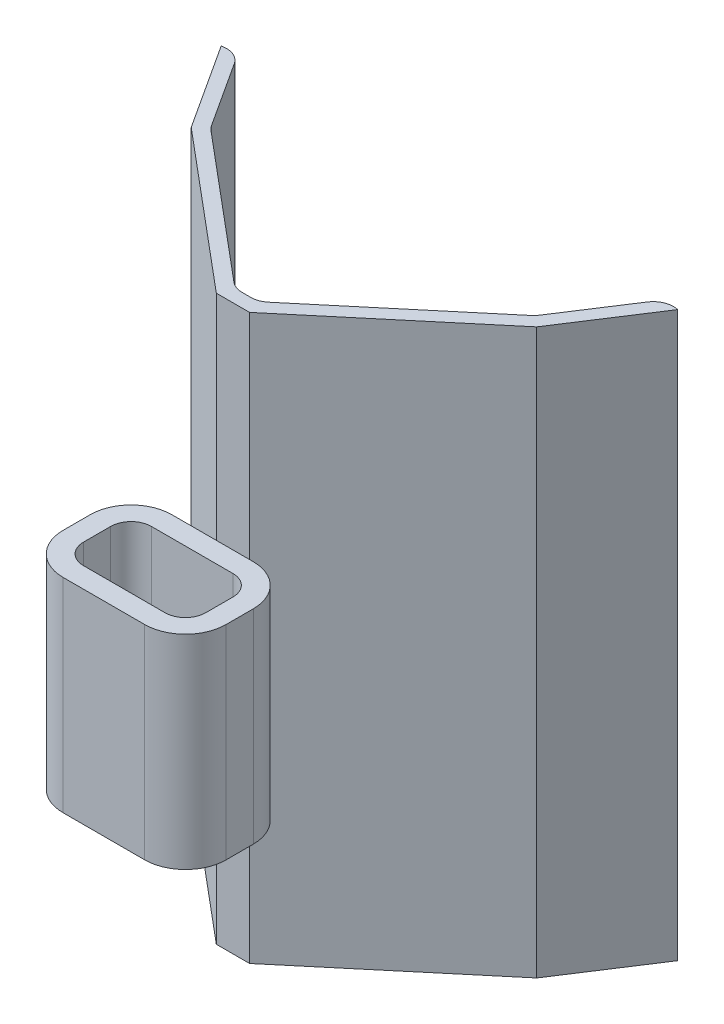
from build123d import *

# Parameters (mm, degrees)
SALIENTE_EXTRUIR1_DEPTH = 30
CROQUIS3_W              = 4.89350096
CROQUIS3_H              = 4.01782184
SALIENTE_EXTRUIR2_DEPTH = 3
SALIENTE_EXTRUIR3_DEPTH = 41.5
REDONDEO2_R             = 3


with BuildPart() as part:
    # Croquis1 → Saliente-Extruir1 (new body)
    with BuildSketch(Plane(origin=(0, 0, 0), x_dir=(1, 0, 0), z_dir=(0, 1, 0))):
        with BuildLine():
            Line((-6, 8), (6, 8))
            ThreePointArc((6, 8), (10.242640687, 6.242640687), (12, 2))
            Line((12, 2), (12, -2))
            ThreePointArc((12, -2), (10.242640687, -6.242640687), (6, -8))
            Line((6, -8), (-6, -8))
            ThreePointArc((-6, -8), (-10.242640687, -6.242640687), (-12, -2))
            Line((-12, -2), (-12, 2))
            ThreePointArc((-12, 2), (-10.242640687, 6.242640687), (-6, 8))
        make_face()
        with BuildLine():
            Line((-6, -5), (6, -5))
            ThreePointArc((6, -5), (8.121320344, -4.121320344), (9, -2))
            Line((9, -2), (9, 2))
            ThreePointArc((9, 2), (8.121320344, 4.121320344), (6, 5))
            Line((6, 5), (-6, 5))
            ThreePointArc((-6, 5), (-8.121320344, 4.121320344), (-9, 2))
            Line((-9, 2), (-9, -2))
            ThreePointArc((-9, -2), (-8.121320344, -4.121320344), (-6, -5))
        make_face(mode=Mode.SUBTRACT)
    extrude(amount=SALIENTE_EXTRUIR1_DEPTH)

    # Croquis3 → Saliente-Extruir2 (add)
    with BuildSketch(Plane(origin=(0, 0, -8), x_dir=(-1, 0, 0), z_dir=(0, 0, -1))):
        with Locations((0, 15)):
            Rectangle(CROQUIS3_W, CROQUIS3_H)
    extrude(amount=SALIENTE_EXTRUIR2_DEPTH)

    # Croquis7 → Saliente-Extruir3 (add, symmetric)
    with BuildSketch(Plane(origin=(0, 17.00891092, 0), x_dir=(1, 0, 0), z_dir=(0, 1, 0))):
        Polygon((-2.44675048, 11), (2.44675048, 11), (25.428083774, 30.283628291), (33.597669299, 42.86368681), (31.920328163, 43.95296488), (23.913536336, 31.623586673), (1.718810011, 13), (-1.718810011, 13), (-23.913536336, 31.623586673), (-31.920328163, 43.95296488), (-33.597669299, 42.86368681), (-25.428083774, 30.283628291), align=None)
    extrude(amount=SALIENTE_EXTRUIR3_DEPTH, both=True)

    # Redondeo2
    # the kernel refuses this fillet: 3 mm, written as the material it adds along each edge
    with BuildSketch(Plane(origin=(-23.913536336, -24.49108908, -31.623586673), x_dir=(0.7660444431189832, 0, 0.6427876096865331), z_dir=(0, 1, 0)), Plane(origin=(23.913536336, -24.49108908, -31.623586673), x_dir=(0.5446390350150309, 0, -0.8386705679454215), z_dir=(0, 1, 0))) as redondeo2_piece_1:
        with BuildLine():
            CenterArc((REDONDEO2_R * 0.149451001349, REDONDEO2_R), REDONDEO2_R, 253, 17)
            Line((-REDONDEO2_R * 0.142920703374, REDONDEO2_R * 0.043695244037), (0, 0))
            Line((0, 0), (REDONDEO2_R * 0.149451001349, 0))
        make_face()
    extrude(amount=83)
    with BuildSketch(Plane(origin=(1.718810011, -24.49108908, -13), x_dir=(0.7660444431189833, 0, -0.6427876096865328), z_dir=(0, 1, 0)), Plane(origin=(-1.718810011, -24.49108908, -13), x_dir=(1, 0, 0), z_dir=(0, 1, 0))) as redondeo2_piece_2:
        with BuildLine():
            CenterArc((REDONDEO2_R * 0.363970234266, REDONDEO2_R), REDONDEO2_R, 230, 40)
            Line((-REDONDEO2_R * 0.27881737542, REDONDEO2_R * 0.233955556881), (0, 0))
            Line((0, 0), (REDONDEO2_R * 0.363970234266, 0))
        make_face()
    extrude(amount=83)
    # the kernel refuses this fillet: 3 mm, written as the material it takes off along each edge
    with BuildSketch(Plane(origin=(31.920328163, -31.562156891, -43.95296488), x_dir=(0.8386705679454225, 0, 0.5446390350150296), z_dir=(0, 1, 0))) as redondeo2_2_piece_1:
        with BuildLine():
            CenterArc((3, -2.828427125), REDONDEO2_R, 109.471220634, 70.528779366)
            Line((0, -2.828427125), (0, 0))
            Line((0, 0), (2, 0))
        make_face()
    extrude(amount=97.142135624, mode=Mode.SUBTRACT)
    with BuildSketch(Plane(origin=(-31.920328163, -31.562156891, -43.95296488), x_dir=(0.5446390350150306, 0, 0.8386705679454217), z_dir=(0, 1, 0))) as redondeo2_2_piece_2:
        with BuildLine():
            CenterArc((2.828427125, -3), REDONDEO2_R, 90, 70.528779366)
            Line((0, -2), (0, 0))
            Line((0, 0), (2.828427125, 0))
        make_face()
    extrude(amount=97.142135624, mode=Mode.SUBTRACT)


solid = part.part
